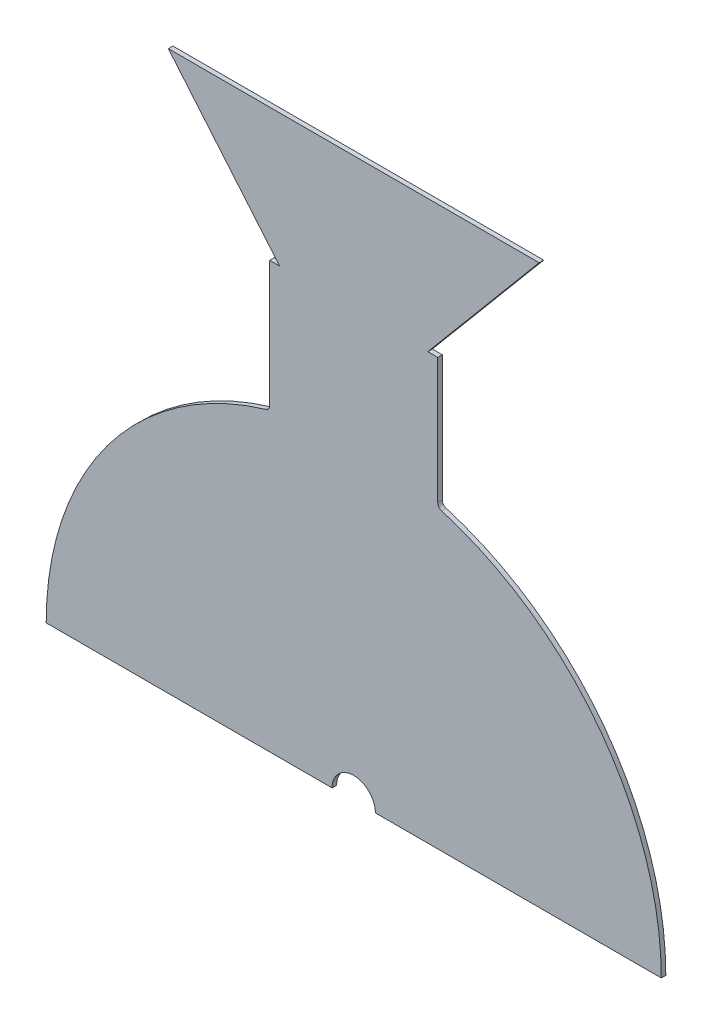
from build123d import *

# Parameters (mm, degrees)
BASE_FLANGE1_DEPTH = 2.65684
FILLET1_R          = 3.175


# Sheet-metal steps are written as plain solids
with BuildPart() as part:
    # Sketch1 → Base-Flange1 (new body)
    with BuildSketch(Plane.XY):
        with BuildLine():
            Line((-180.45684, 0), (-12.7, 0))
            ThreePointArc((-12.7, 0), (0, 12.7), (12.7, 0))
            Line((12.7, 0), (180.45684, 0))
            ThreePointArc((180.45684, 0), (143.97849234, 108.788165011), (49.29124, 173.594483674))
            Line((49.29124, 173.594483674), (49.29124, 249.794483674))
            Line((49.29124, 249.794483674), (43.488704599, 249.794483674))
            Line((43.488704599, 249.794483674), (108.795925743, 327.624599095))
            Line((108.795925743, 327.624599095), (-108.795925743, 327.624599095))
            Line((-108.795925743, 327.624599095), (-43.488704599, 249.794483674))
            Line((-43.488704599, 249.794483674), (-49.29124, 249.794483674))
            Line((-49.29124, 249.794483674), (-49.29124, 173.594483674))
            ThreePointArc((-49.29124, 173.594483674), (-143.97849234, 108.788165011), (-180.45684, 0))
        make_face()
    extrude(amount=-BASE_FLANGE1_DEPTH)

    # Fillet1
    fillet1_edges = [part.edges().sort_by_distance(p)[0] for p in [
        (-49.29124, 173.594483674, -1.32842),
        (49.29124, 173.594483674, -1.32842),
    ]]
    fillet(fillet1_edges, radius=FILLET1_R)


solid = part.part
